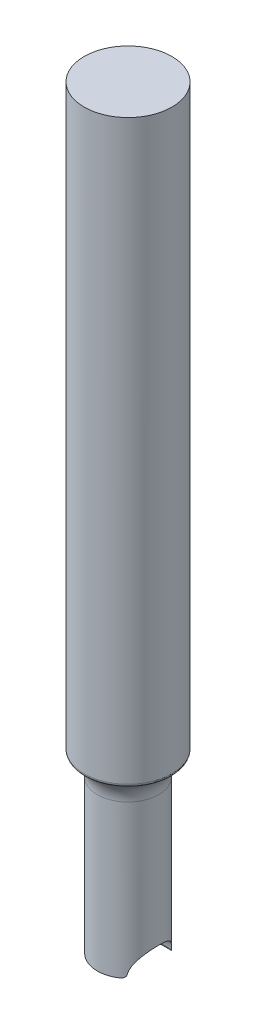
from build123d import *

# Parameters (mm, degrees)
SKETCH1_R               = 6.35
BOSS_EXTRUDE1_DEPTH     = 83.82
SKETCH3_R               = 4.445
BOSS_EXTRUDE2_DEPTH     = 25.4
FILLET1_R               = 3.81
CUT_EXTRUDE1_DEPTH      = 7.62
CUT_EXTRUDE1_DEPTH_BACK = 7.62
SKETCH4_R               = 3.2385
FILLET2_R               = 0.508


with BuildPart() as part:
    # Sketch1 → Boss-Extrude1 (new body)
    with BuildSketch(Plane(origin=(0, 0, 0), x_dir=(1, 0, 0), z_dir=(0, 1, 0))):
        with Locations(Location((0, 0, 0), (0, 0, 270))):
            Circle(SKETCH1_R)
    extrude(amount=BOSS_EXTRUDE1_DEPTH)

    # Sketch3 → Boss-Extrude2 (add)
    with BuildSketch(Plane(origin=(0, 0, 0), x_dir=(1, 0, 0), z_dir=(0, 1, 0))):
        with Locations(Location((0, 0, 0), (0, 0, 270))):
            Circle(SKETCH3_R)
    extrude(amount=-BOSS_EXTRUDE2_DEPTH)

    # Fillet1
    # the kernel refuses this fillet: 3.81 mm, written as the material it adds along each edge
    with BuildSketch(Plane(origin=(0, 0, 0), x_dir=(0, 0, 1), z_dir=(-1, 0, 0))) as fillet1_piece_1:
        with BuildLine():
            CenterArc((8.255, -3.299556788), FILLET1_R, 120, 60)
            Line((4.445, -3.299556788), (4.3688, -3.299556788))
            Line((4.3688, -3.299556788), (4.3688, 0))
            Line((4.3688, 0), (4.445, 0.0762))
            ThreePointArc((4.445, 0.0762), (5.3975, 0.0762), (6.3119, 0.065991136))
            Line((6.3119, 0.065991136), (6.35, 0))
        make_face()
    revolve(axis=Axis((0, 0, 0), (0, 1, 0)))

    # Sketch4 → Cut-Extrude1 (cut, two sides: drawn at the far end of the back side and taken through both)
    with BuildSketch(Plane(origin=(0, 0, 0), x_dir=(0, 0, -1), z_dir=(1, 0, 0)).offset(-CUT_EXTRUDE1_DEPTH_BACK)):
        with Locations((0, -25.4)):
            Circle(SKETCH4_R)
    extrude(amount=CUT_EXTRUDE1_DEPTH + CUT_EXTRUDE1_DEPTH_BACK, mode=Mode.SUBTRACT)

    # Fillet2
    fillet2_edges = [part.edges().sort_by_distance(p)[0] for p in [
        (0, -25.4, -3.2385),
        (0, -25.4, 3.2385),
        (0, 0, -6.35),
    ]]
    fillet(fillet2_edges, radius=FILLET2_R)


solid = part.part
